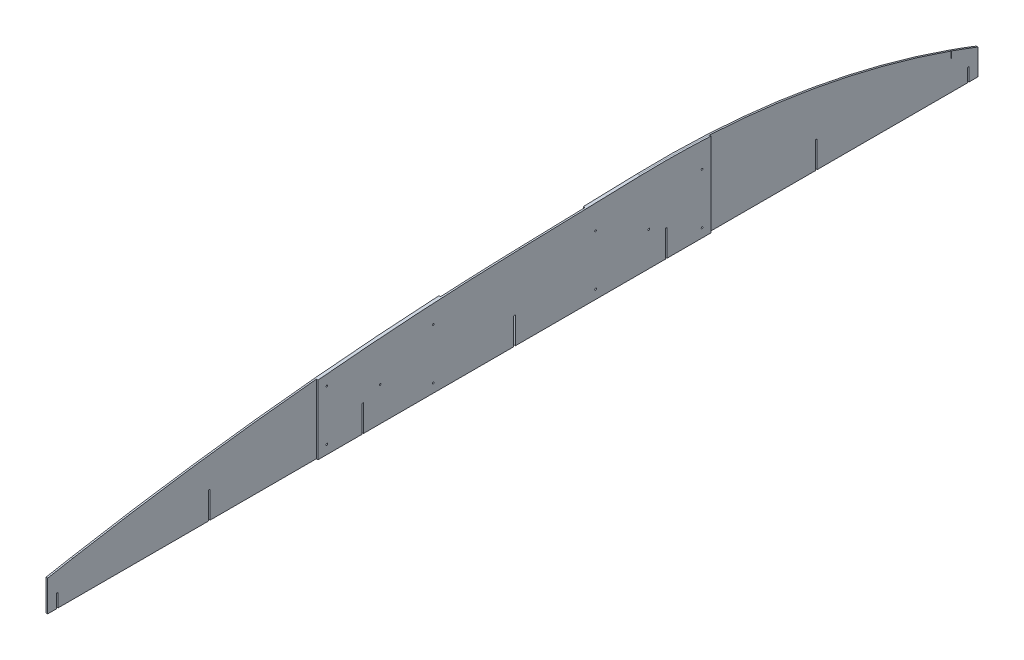
from build123d import *

# Parameters (mm, degrees)
SKETCH1_R               = 4.7625
BOSS_EXTRUDE1_DEPTH     = 9.398
BOSS_EXTRUDE2_START     = -9.398
SKETCH2_R               = 4.7625
BOSS_EXTRUDE2_DEPTH     = 9.398
BOSS_EXTRUDE3_START     = -9.398
BOSS_EXTRUDE3_OUTLINE_R = 4.7625
BOSS_EXTRUDE3_DEPTH     = 9.398


# Read off the part's stored shape, not the designer's step: Boss-Extrude3
with BuildPart() as part:
    # Sketch1 → Boss-Extrude1 (new body)
    with BuildSketch(Plane(origin=(0, 0, 0), x_dir=(0, 0, -1), z_dir=(1, 0, 0))):
        with BuildLine():
            Line((-1117.6, 0), (-867.643042413, 0))
            Line((-867.643042413, 0), (-867.643042413, 152.4))
            Line((-867.643042413, 152.4), (-858.245042413, 152.4))
            Line((-858.245042413, 152.4), (-858.245042413, 0))
            Line((-858.245042413, 0), (-4.699, 0))
            Line((-4.699, 0), (-4.699, 152.4))
            Line((-4.699, 152.4), (4.699, 152.4))
            Line((4.699, 152.4), (4.699, 0))
            Line((4.699, 0), (858.245042413, 0))
            Line((858.245042413, 0), (858.245042413, 152.4))
            Line((858.245042413, 152.4), (867.643042413, 152.4))
            Line((867.643042413, 152.4), (867.643042413, 0))
            Line((867.643042413, 0), (1117.6, 0))
            Line((1117.6, 0), (1117.6, 476.920342363))
            ThreePointArc((1117.6, 476.920342363), (917.240633935, 483.623214487), (716.77434461, 482.184149316))
            Line((716.77434461, 482.184149316), (35.031995638, 463.439293515))
            ThreePointArc((35.031995638, 463.439293515), (-541.884884831, 437.78090817), (-1117.6, 392.575312556))
            Line((-1117.6, 392.575312556), (-1117.6, 0))
        make_face()
        with Locations((-1066.8, 337.933597897)):
            Circle(SKETCH1_R, mode=Mode.SUBTRACT)
        with Locations((-1066.8, 50.8)):
            Circle(SKETCH1_R, mode=Mode.SUBTRACT)
        with Locations((-461.243042413, 50.8)):
            Circle(SKETCH1_R, mode=Mode.SUBTRACT)
        with Locations((-461.243042413, 337.933597897)):
            Circle(SKETCH1_R, mode=Mode.SUBTRACT)
        with Locations((-764.021521207, 194.366798948)):
            Circle(SKETCH1_R, mode=Mode.SUBTRACT)
        with Locations((1066.8, 337.933597897)):
            Circle(SKETCH1_R, mode=Mode.SUBTRACT)
        with Locations((1066.8, 50.8)):
            Circle(SKETCH1_R, mode=Mode.SUBTRACT)
        with Locations((461.243042413, 50.8)):
            Circle(SKETCH1_R, mode=Mode.SUBTRACT)
        with Locations((461.243042413, 337.933597897)):
            Circle(SKETCH1_R, mode=Mode.SUBTRACT)
        with Locations((764.021521207, 194.366798948)):
            Circle(SKETCH1_R, mode=Mode.SUBTRACT)
    extrude(amount=BOSS_EXTRUDE1_DEPTH)

    # Sketch2 → Boss-Extrude2 (add)
    with BuildSketch(Plane(origin=(0, 0, 0), x_dir=(0, 0, -1), z_dir=(1, 0, 0)).offset(BOSS_EXTRUDE2_START)):
        with BuildLine():
            Line((-2499.151810434, 203.132072467), (-2498.739585654, 188.139634391))
            Line((-2498.739585654, 188.139634391), (-2498.358729591, 188.150106224))
            Line((-2498.358729591, 188.150106224), (-2498.772534145, 203.199999989))
            ThreePointArc((-2498.772534145, 203.199999989), (-1458.348299788, 356.534349508), (-410.443042359, 445.352037108))
            Line((-410.443042359, 445.352037108), (-410.443042359, 9e-09))
            Line((-410.443042359, 9e-09), (-858.245042361, 9e-09))
            Line((-858.245042361, 9e-09), (-858.245042361, 152.400000009))
            Line((-858.245042361, 152.400000009), (-867.643042361, 152.400000009))
            Line((-867.643042361, 152.400000009), (-867.643042361, 9e-09))
            Line((-867.643042361, 9e-09), (-1721.845042361, 9e-09))
            Line((-1721.845042361, 9e-09), (-1721.845042361, 152.400000009))
            Line((-1721.845042361, 152.400000009), (-1731.243042361, 152.400000009))
            Line((-1731.243042361, 152.400000009), (-1731.243042361, 9e-09))
            Line((-1731.243042361, 9e-09), (-2585.445042361, 9e-09))
            Line((-2585.445042361, 9e-09), (-2585.445042361, 76.200000009))
            Line((-2585.445042361, 76.200000009), (-2594.843042361, 76.200000009))
            Line((-2594.843042361, 76.200000009), (-2594.843042361, 9e-09))
            Line((-2594.843042361, 9e-09), (-2645.643042361, 9e-09))
            Line((-2645.643042361, 9e-09), (-2645.643042361, 176.232398874))
            ThreePointArc((-2645.643042361, 176.232398874), (-2572.426836141, 189.842396334), (-2499.151810434, 203.132072467))
        make_face()
        with Locations((-1066.8, 337.933597897)):
            Circle(SKETCH2_R, mode=Mode.SUBTRACT)
        with Locations((-1066.8, 50.8)):
            Circle(SKETCH2_R, mode=Mode.SUBTRACT)
        with Locations((-461.243042413, 50.8)):
            Circle(SKETCH2_R, mode=Mode.SUBTRACT)
        with Locations((-461.243042413, 337.933597897)):
            Circle(SKETCH2_R, mode=Mode.SUBTRACT)
        with Locations((-764.021521207, 194.366798948)):
            Circle(SKETCH2_R, mode=Mode.SUBTRACT)
    extrude(amount=BOSS_EXTRUDE2_DEPTH)

    # Boss-Extrude3 outline → Boss-Extrude3 (add)
    with BuildSketch(Plane(origin=(0, 0, 0), x_dir=(0, 0, -1), z_dir=(1, 0, 0)).offset(BOSS_EXTRUDE3_START)):
        with BuildLine():
            Line((410.443027364, 0), (858.245042413, 0))
            Line((858.245042413, 0), (858.245027364, 152.400005306))
            Line((858.245027364, 152.400005306), (867.643042413, 152.4))
            Line((867.643042413, 152.4), (867.643027364, 2.653e-06))
            Line((867.643027364, 2.653e-06), (1721.845027364, 0))
            Line((1721.845027364, 0), (1721.845027364, 152.400005306))
            Line((1721.845027364, 152.400005306), (1731.243027364, 152.400005306))
            Line((1731.243027364, 152.400005306), (1731.243027364, 5.306e-06))
            Line((1731.243027364, 5.306e-06), (2585.445027364, 5.306e-06))
            Line((2585.445027364, 5.306e-06), (2585.445027364, 76.200005306))
            Line((2585.445027364, 76.200005306), (2594.843027364, 76.200005306))
            Line((2594.843027364, 76.200005306), (2594.843027364, 5.306e-06))
            Line((2594.843027364, 5.306e-06), (2645.643026542, 5.306e-06))
            Line((2645.643026542, 5.306e-06), (2645.643026542, 146.767309802))
            ThreePointArc((2645.643026542, 146.767309802), (2569.865266677, 175.603675529), (2493.624041275, 203.19136169))
            Line((2493.624041275, 203.19136169), (2493.624041275, 167.187967798))
            Line((2493.624041275, 167.187967798), (2493.243041275, 167.187967798))
            Line((2493.243041275, 167.187967798), (2493.243041275, 203.325679209))
            ThreePointArc((2493.243041275, 203.325679209), (1617.815646166, 424.341696828), (716.774329561, 482.184154622))
            Line((716.774329561, 482.184154622), (410.443027521, 473.761412523))
            Line((410.443027521, 473.761412523), (410.443027364, 0))
        make_face()
        with Locations((461.243042413, 50.8)):
            Circle(BOSS_EXTRUDE3_OUTLINE_R, mode=Mode.SUBTRACT)
        with Locations((1066.8, 50.8)):
            Circle(BOSS_EXTRUDE3_OUTLINE_R, mode=Mode.SUBTRACT)
        with Locations((764.021521207, 194.366798948)):
            Circle(BOSS_EXTRUDE3_OUTLINE_R, mode=Mode.SUBTRACT)
        with Locations((461.243042413, 337.933597897)):
            Circle(BOSS_EXTRUDE3_OUTLINE_R, mode=Mode.SUBTRACT)
        with Locations((1066.8, 337.933597897)):
            Circle(BOSS_EXTRUDE3_OUTLINE_R, mode=Mode.SUBTRACT)
    extrude(amount=BOSS_EXTRUDE3_DEPTH)


solid = part.part
